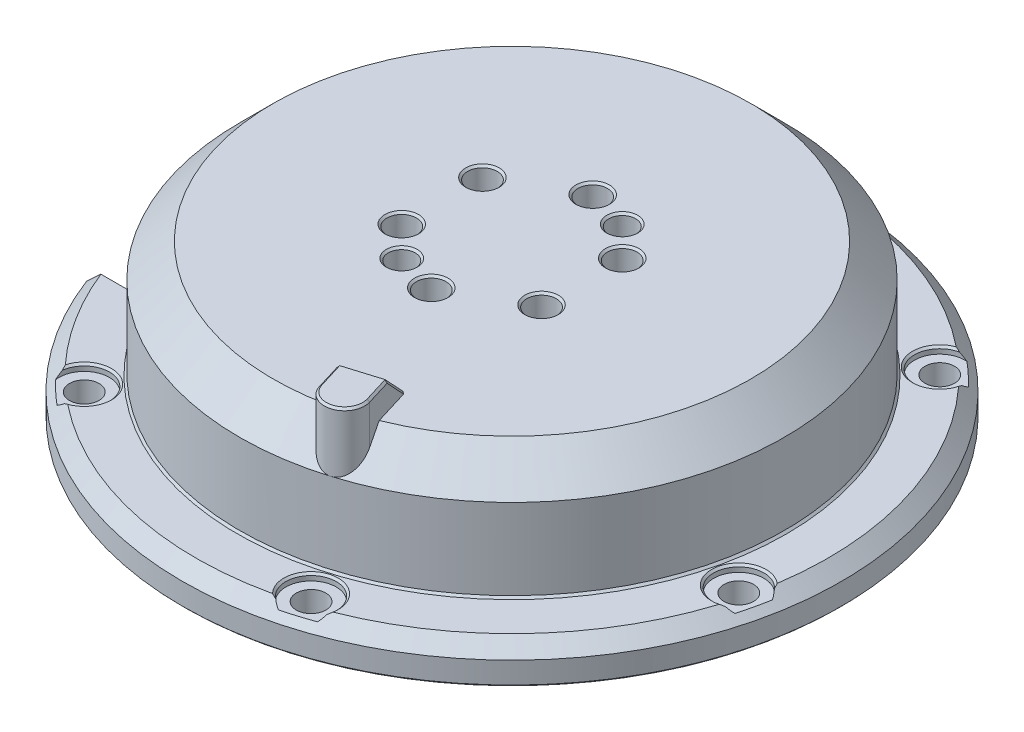
from build123d import *

# Parameters (mm, degrees)
SKETCH_1_R          = 49
SKETCH_1_R_2        = 40.5
EXTRUDE_1_DEPTH     = 5.5
SKETCH_1_5_R        = 40.5
SKETCH_1_5_R_2      = 36.5
EXTRUDE_2_DEPTH     = 17.8
EXTRUDE_START       = 17.8
SKETCH_1_6_R        = 40.5
SKETCH_1_6_R_2      = 36.5
EXTRUDE_3_DEPTH     = 5
SKETCH_2_R          = 2.2
CUT_EXTRUDE_1_DEPTH = 50
SKETCH_3_R          = 2.2
CUT_EXTRUDE_2_DEPTH = 50
SKETCH_4_W          = 33.937530488
SKETCH_4_H          = 35
CUT_EXTRUDE_3_DEPTH = 11
SKETCH_7_R          = 3.75
CUT_EXTRUDE_5_DEPTH = 1
CHAMFER_8_SIZE      = 0.3
CHAMFER_9_SIZE      = 2
CHAMFER_11_SIZE     = 0.3
SKETCH_8_R          = 3
EXTRUDE_4_DEPTH     = 4
CHAMFER_START       = 17.800013545
CHAMFER_12_2_DEPTH  = 4.999986455
CUT_EXTRUDE_8_DEPTH = 10
CHAMFER_13_SIZE     = 0.3
SKETCH_2_3_R        = 2
CUT_EXTRUDE_9_DEPTH = 4.5
CHAMFER_10_SIZE     = 0.3


with BuildPart() as part:
    # 스케치1 → 보스-돌출1 (new body)
    with BuildSketch(Plane(origin=(0, 0, 0), x_dir=(1, 0, 0), z_dir=(0, 1, 0))):
        with Locations(Location((0, 0, 0), (0, 0, 270))):
            Circle(SKETCH_1_R)
        with Locations(Location((0, 0, 0), (0, 0, 270))):
            Circle(SKETCH_1_R_2, mode=Mode.SUBTRACT)
    extrude(amount=EXTRUDE_1_DEPTH)

    # 스케치1<5> → 보스-돌출2 (add)
    with BuildSketch(Plane(origin=(0, 0, 0), x_dir=(1, 0, 0), z_dir=(0, 1, 0))):
        with Locations(Location((0, 0, 0), (0, 0, 270))):
            Circle(SKETCH_1_5_R)
        with Locations(Location((0, 0, 0), (0, 0, 270))):
            Circle(SKETCH_1_5_R_2, mode=Mode.SUBTRACT)
    extrude(amount=EXTRUDE_2_DEPTH)

    # 스케치1<6> → 보스-돌출3 (add)
    # profile 1 of 2: a face of its own
    with BuildSketch(Plane(origin=(0, 0, 0), x_dir=(1, 0, 0), z_dir=(0, 1, 0)).offset(EXTRUDE_START)):
        with Locations(Location((0, 0, 0), (0, 0, 270))):
            Circle(SKETCH_1_6_R)
        with Locations(Location((0, 0, 0), (0, 0, 270))):
            Circle(SKETCH_1_6_R_2, mode=Mode.SUBTRACT)
    # profile 2 of 2: a face of its own
    with BuildSketch(Plane(origin=(0, 0, 0), x_dir=(1, 0, 0), z_dir=(0, 1, 0)).offset(EXTRUDE_START)):
        with Locations(Location((0, 0, 0), (0, 0, 270))):
            Circle(SKETCH_1_6_R_2)
    extrude(amount=EXTRUDE_3_DEPTH)

    # 스케치2 → 컷-돌출1 (cut)
    with BuildSketch(Plane(origin=(0, 22.8, 0), x_dir=(1, 0, 0), z_dir=(0, 1, 0))):
        with Locations(Location((0, 12, 0), (0, 0, 270))):
            Circle(SKETCH_2_R)
        with Locations(Location((10.392304845, 6, 0), (0, 0, 270))):
            Circle(SKETCH_2_R)
        with Locations(Location((10.392304845, -6, 0), (0, 0, 270))):
            Circle(SKETCH_2_R)
        with Locations(Location((0, -12, 0), (0, 0, 270))):
            Circle(SKETCH_2_R)
        with Locations(Location((-10.392304845, -6, 0), (0, 0, 270))):
            Circle(SKETCH_2_R)
        with Locations(Location((-10.392304845, 6, 0), (0, 0, 270))):
            Circle(SKETCH_2_R)
    extrude(amount=-CUT_EXTRUDE_1_DEPTH, mode=Mode.SUBTRACT)

    # 스케치3 → 컷-돌출2 (cut)
    with BuildSketch(Plane(origin=(0, 5.5, 0), x_dir=(1, 0, 0), z_dir=(0, 1, 0))):
        with Locations(Location((-43.846652915, 10.122797445, 0), (0, 0, 270))):
            Circle(SKETCH_3_R)
        with Locations(Location((-13.156726713, 43.033714018, 0), (0, 0, 270))):
            Circle(SKETCH_3_R)
        with Locations(Location((30.689926203, 32.910916573, 0), (0, 0, 270))):
            Circle(SKETCH_3_R)
        with Locations(Location((43.846652915, -10.122797445, 0), (0, 0, 270))):
            Circle(SKETCH_3_R)
        with Locations(Location((13.156726713, -43.033714018, 0), (0, 0, 270))):
            Circle(SKETCH_3_R)
        with Locations(Location((-30.689926203, -32.910916573, 0), (0, 0, 270))):
            Circle(SKETCH_3_R)
    extrude(amount=-CUT_EXTRUDE_2_DEPTH, mode=Mode.SUBTRACT)

    # 스케치4 → 컷-돌출3 (cut)
    with BuildSketch(Plane.XZ):
        with Locations((-49, 0)):
            Rectangle(SKETCH_4_W, SKETCH_4_H)
    extrude(amount=-CUT_EXTRUDE_3_DEPTH, mode=Mode.SUBTRACT)

    # 스케치7 → 컷-돌출5 (cut)
    with BuildSketch(Plane(origin=(0, 5.5, 0), x_dir=(1, 0, 0), z_dir=(0, 1, 0))):
        with Locations(Location((-13.156726713, 43.033714018, 0), (0, 0, 270))):
            Circle(SKETCH_7_R)
        with Locations(Location((30.689926203, 32.910916573, 0), (0, 0, 270))):
            Circle(SKETCH_7_R)
        with Locations(Location((43.846652915, -10.122797445, 0), (0, 0, 270))):
            Circle(SKETCH_7_R)
        with Locations(Location((13.156726713, -43.033714018, 0), (0, 0, 270))):
            Circle(SKETCH_7_R)
        with Locations(Location((-30.689926203, -32.910916573, 0), (0, 0, 270))):
            Circle(SKETCH_7_R)
        with Locations((-43.846652915, 10.122797445)):
            Circle(SKETCH_7_R)
    extrude(amount=-CUT_EXTRUDE_5_DEPTH, mode=Mode.SUBTRACT)

    # 모따기8
    chamfer_8_edges = [part.edges().sort_by_distance(p)[0] for p in [
        (-38.899836832, 0, 17.5),
        (-38.899836832, 0, -17.5),
        (0, 17.8, -36.5),
        (31.392674305, 0, -18.62122445),
        (49, 0, 0),
        (-34.277599746, 11, -17.5),
        (-34.277599746, 11, 17.5),
    ]]
    chamfer(chamfer_8_edges, length=CHAMFER_8_SIZE)

    # 모따기9
    # the kernel refuses this chamfer: 2 mm, written as the material it takes off along each edge
    with BuildSketch(Plane(origin=(0, 5.5, 0), x_dir=(-0.9664639916292301, 0, -0.25680216682126217), z_dir=(-0.25680216682126217, 0, 0.9664639916292301))) as chamfer_9_piece_1:
        Polygon((49, CHAMFER_9_SIZE), (49 - CHAMFER_9_SIZE, 0), (49, 0), align=None)
    revolve(axis=Axis((0, 5.5, 0), (0, -1, 0)), revolution_arc=330.239203437, mode=Mode.SUBTRACT)

    # 모따기11
    chamfer_11_edges = [part.edges().sort_by_distance(p)[0] for p in [
        (34.270978976, 5.5, -21.581241855),
    ]]
    chamfer(chamfer_11_edges, length=CHAMFER_11_SIZE)

    # 스케치8 → 보스-돌출4 (add)
    with BuildSketch(Plane(origin=(0, 22.8, 0), x_dir=(1, 0, 0), z_dir=(0, 1, 0))):
        with Locations((10.963938927, -35.861428349)):
            Circle(SKETCH_8_R)
        with BuildLine():
            Line((11.493879557, -27.333875187), (5.756051021, -29.088105415))
            Line((5.756051021, -29.088105415), (8.095024659, -36.738543463))
            ThreePointArc((8.095024659, -36.738543463), (10.086823813, -32.992514081), (13.832853195, -34.984313234))
            Line((13.832853195, -34.984313234), (11.493879557, -27.333875187))
        make_face()
    extrude(amount=EXTRUDE_4_DEPTH)

    # 모따기12: read off the stored shape, not the designer's step
    # 모따기12 outline → 모따기12 (revolve, cut)
    with BuildSketch(Plane.XY):
        Polygon((40.5, 22.8), (35.5, 22.8), (40.5, 17.8), align=None)
    revolve(axis=Axis((0, 0, 0), (0, 1, 0)), mode=Mode.SUBTRACT)

    # Chamfer 12 2 outline → Chamfer 12 2 (add)
    with BuildSketch(Plane(origin=(0, 0, 0), x_dir=(1, 0, 0), z_dir=(0, 1, 0)).offset(CHAMFER_START)):
        with BuildLine():
            ThreePointArc((8.095024659, -36.738543463), (11.841054042, -38.730342617), (13.832853195, -34.984313234))
            Line((13.832853195, -34.984313234), (12.614726395, -31))
            Line((12.614726395, -31), (6.340575855, -31))
            Line((6.340575855, -31), (8.095024659, -36.738543463))
        make_face()
    extrude(amount=CHAMFER_12_2_DEPTH)

    # 스케치10 → 컷-돌출8 (cut)
    with BuildSketch(Plane(origin=(-2.868914268, 0, 0.877115114), x_dir=(0.29237170472273827, 0, 0.9563047559630351), z_dir=(-0.9563047559630351, 0, 0.29237170472273827))):
        Polygon((29.5, 22.8), (33.5, 26.8), (29.5, 26.8), align=None)
    extrude(amount=-CUT_EXTRUDE_8_DEPTH, mode=Mode.SUBTRACT)

    # 모따기13
    chamfer_13_edges = [part.edges().sort_by_distance(p)[0] for p in [
        (11.841054041, 26.8, 38.730342617),
        (13.248109786, 26.8, 33.071703723),
        (7.51028125, 26.8, 34.825933951),
        (12.078622967, 24.8, 29.246484699),
        (6.340794431, 24.8, 31.000714927),
    ]]
    chamfer(chamfer_13_edges, length=CHAMFER_13_SIZE)

    # 스케치2<3> → 컷-돌출9 (cut)
    with BuildSketch(Plane(origin=(0, 22.8, 0), x_dir=(1, 0, 0), z_dir=(0, 1, 0))):
        with Locations(Location((6, 10.392304845, 0), (0, 0, 270))):
            Circle(SKETCH_2_3_R)
        with Locations(Location((-6, -10.392304845, 0), (0, 0, 270))):
            Circle(SKETCH_2_3_R)
    extrude(amount=-CUT_EXTRUDE_9_DEPTH, mode=Mode.SUBTRACT)

    # 모따기10
    chamfer_10_edges = [part.edges().sort_by_distance(p)[0] for p in [
        (28.132432353, 5.5, -30.168340192),
        (40.192765172, 5.5, 9.279230992),
        (12.06033282, 5.5, 39.447571183),
        (-28.132432353, 5.5, 30.168340192),
        (-12.06033282, 5.5, -39.447571183),
        (0, 17.8, -14.2),
        (-10.392304845, 17.8, -8.2),
        (-10.392304845, 17.8, 3.8),
        (0, 17.8, 9.8),
        (10.392304845, 17.8, -8.2),
        (10.392304845, 17.8, 3.8),
        (0, 22.8, -14.2),
        (-10.392304845, 22.8, -8.2),
        (-10.392304845, 22.8, 3.8),
        (-6, 22.8, 8.392304845),
        (0, 22.8, 9.8),
        (10.392304845, 22.8, 3.8),
        (6, 22.8, -12.392304845),
        (10.392304845, 22.8, -8.2),
    ]]
    chamfer(chamfer_10_edges, length=CHAMFER_10_SIZE)


solid = part.part
